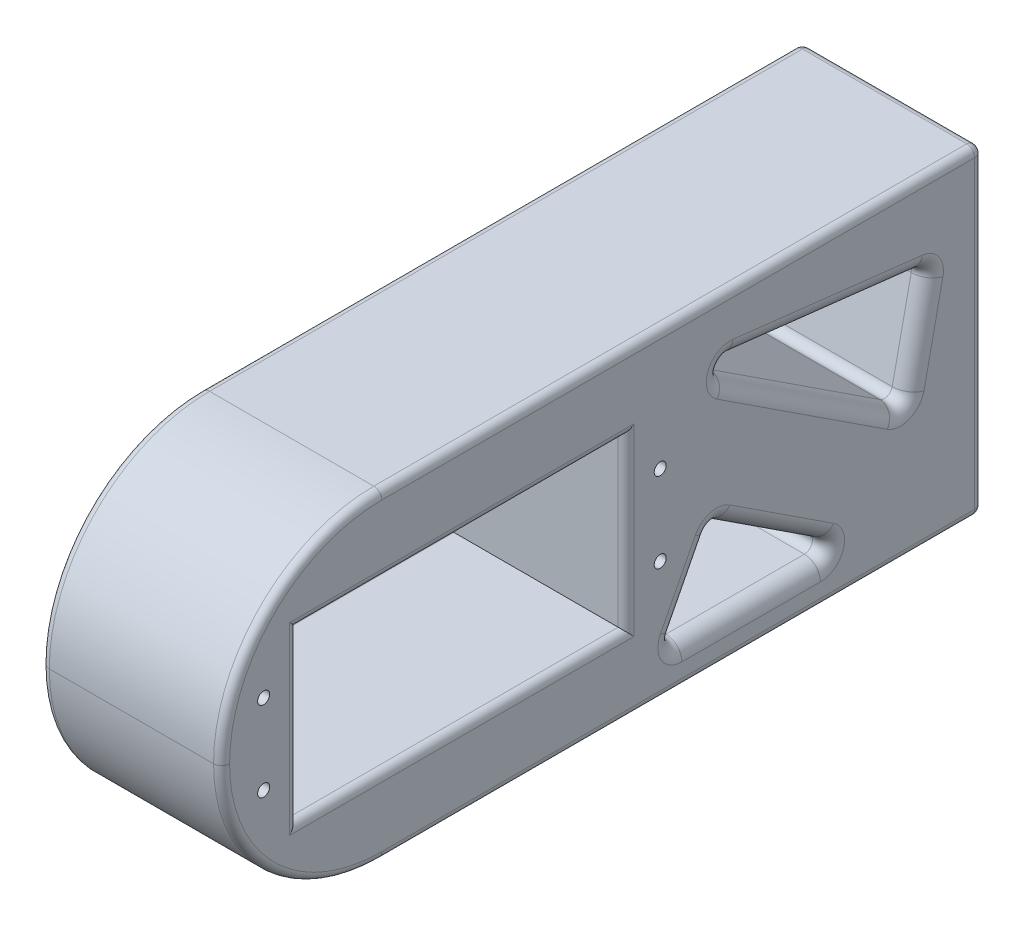
from build123d import *

# Parameters (mm, degrees)
MBODY_DEPTH        = 40
SKETCH5_R          = 0.75
FRONTSCREWS_DEPTH  = 3
SKETCH7_R          = 2.75
GUIDKNOB_DEPTH     = 4
SERVOCUT_DEPTH     = 40.5
ROUNDEND_R         = 20
SKETCH15_R         = 0.75
SERVOSCREWS_DEPTH  = 3
EDGES1MM_R         = 1
CUT_EXTRUDE2_DEPTH = 25
FILLET5_R          = 2


with BuildPart() as part:
    # Sketch4 → MBODY (new body)
    with BuildSketch(Plane(origin=(0, 0, 0), x_dir=(1, 0, 0), z_dir=(0, 1, 0))):
        Polygon((-5, 20), (-16.25, 20), (-16.25, -75), (-5, -75), (6.25, -75), (6.25, 20), align=None)
    extrude(amount=MBODY_DEPTH)

    # Sketch5 → FrontScrews (cut)
    with BuildSketch(Plane(origin=(0, 0, -20), x_dir=(-1, 0, 0), z_dir=(0, 0, -1))):
        with Locations((0, 5)):
            Circle(SKETCH5_R)
        with Locations((10, 5)):
            Circle(SKETCH5_R)
        with Locations((10, 15)):
            Circle(SKETCH5_R)
        with Locations((0, 15)):
            Circle(SKETCH5_R)
        with Locations((0, 25)):
            Circle(SKETCH5_R)
        with Locations((10, 25)):
            Circle(SKETCH5_R)
        with Locations((10, 35)):
            Circle(SKETCH5_R)
        with Locations((0, 35)):
            Circle(SKETCH5_R)
    extrude(amount=-FRONTSCREWS_DEPTH, mode=Mode.SUBTRACT)

    # Sketch7 → GUIDKNOB (add)
    with BuildSketch(Plane(origin=(0, 0, -20), x_dir=(-1, 0, 0), z_dir=(0, 0, -1))):
        with Locations((5, 20)):
            Circle(SKETCH7_R)
    extrude(amount=GUIDKNOB_DEPTH)

    # Sketch10 → ServoCut (cut)
    with BuildSketch(Plane(origin=(6.25, 0, 0), x_dir=(0, 0, -1), z_dir=(1, 0, 0))):
        Polygon((-65.5, 20), (-65.5, 30.5), (-24.5, 30.5), (-24.5, 9.5), (-65.5, 9.5), align=None)
    extrude(amount=-SERVOCUT_DEPTH, mode=Mode.SUBTRACT)

    # RoundEnd
    roundend_edges = [part.edges().sort_by_distance(p)[0] for p in [
        (-5, 0, 75),
        (-5, 40, 75),
    ]]
    fillet(roundend_edges, radius=ROUNDEND_R - 0.0001)  # a hair under: the kernel refuses the full size

    # Sketch15 → ServoScrews (cut)
    with BuildSketch(Plane(origin=(6.25, 33.75, 0), x_dir=(0, 1, 0), z_dir=(-1, 0, 0))):
        with Locations(Location((-18.75, -69.75, 0), (0, 0, 270))):
            Circle(SKETCH15_R)
        with Locations(Location((-8.75, -69.75, 0), (0, 0, 270))):
            Circle(SKETCH15_R)
        with Locations(Location((-8.75, -20.25, 0), (0, 0, 270))):
            Circle(SKETCH15_R)
        with Locations(Location((-18.75, -20.25, 0), (0, 0, 270))):
            Circle(SKETCH15_R)
    extrude(amount=SERVOSCREWS_DEPTH, mode=Mode.SUBTRACT)

    # EDGES1MM
    edges1mm_edges = [part.edges().sort_by_distance(p)[0] for p in [
        (-16.25, 20, -20),
        (6.25, 20, -20),
        (6.25, 40, 17.50005),
        (-5, 40, -20),
        (-16.25, 40, 17.50005),
        (6.25, 20, 65.5),
        (6.25, 30.5, 45),
        (-16.25, 20, 24.5),
        (-16.25, 9.5, 45),
        (-16.25, 20, 65.5),
        (-16.25, 30.5, 45),
        (-5, 0, -20),
        (6.25, 9.5, 45),
        (6.25, 20, 24.5),
        (6.25, 0, 17.50005),
        (6.25, 34.142164913, 69.142164913),
        (6.25, 5.857835087, 69.142164913),
        (-16.25, 34.142164913, 69.142164913),
        (-16.25, 5.857835087, 69.142164913),
        (-16.25, 0, 17.50005),
    ]]
    fillet(edges1mm_edges, radius=EDGES1MM_R)

    # Sketch20 → Cut-Extrude2 (cut)
    with BuildSketch(Plane.ZY.offset(16.25)):
        with BuildLine():
            Line((-12.215168046, 29.74634987), (11.383359391, 32.473817865))
            ThreePointArc((11.383359391, 32.473817865), (12.438571666, 31.820504762), (12.045296334, 30.643378825))
            Line((12.045296334, 30.643378825), (-9.181519802, 16.768867719))
            ThreePointArc((-9.181519802, 16.768867719), (-10.109863888, 16.681435652), (-10.706749095, 17.397812059))
            Line((-10.706749095, 17.397812059), (-13.078460395, 28.54485517))
            ThreePointArc((-13.078460395, 28.54485517), (-12.91246015, 29.33647319), (-12.215168046, 29.74634987))
        make_face()
        with BuildLine():
            Line((12.659206955, 15.077659132), (-0.290565805, 6.613282524))
            ThreePointArc((-0.290565805, 6.613282524), (-0.701840058, 5.490794018), (0.256557559, 4.776230539))
            Line((0.256557559, 4.776230539), (17.543908561, 4.776230539))
            ThreePointArc((17.543908561, 4.776230539), (18.397154203, 5.254721313), (18.433859511, 6.232286792))
            Line((18.433859511, 6.232286792), (14.09628127, 14.696663401))
            ThreePointArc((14.09628127, 14.696663401), (13.462596051, 15.207213518), (12.659206955, 15.077659132))
        make_face()
    extrude(amount=-CUT_EXTRUDE2_DEPTH, mode=Mode.SUBTRACT)

    # Fillet5
    fillet5_edges = [part.edges().sort_by_distance(p)[0] for p in [
        (6.25, 31.110083867, -0.415904328),
        (6.25, 29.33647319, -12.91246015),
        (6.25, 22.971333615, -11.892604745),
        (6.25, 16.681435652, -10.109863888),
        (6.25, 23.706123272, 1.431888266),
        (6.25, 31.820504762, 12.438571666),
        (6.25, 10.845470828, 6.184320575),
        (6.25, 5.490794018, -0.701840058),
        (6.25, 4.776230539, 8.90023306),
        (6.25, 5.254721313, 18.397154203),
        (6.25, 10.464475096, 16.26507039),
        (6.25, 15.207213518, 13.462596051),
        (-16.25, 15.207213518, 13.462596051),
        (-16.25, 10.845470828, 6.184320575),
        (-16.25, 5.490794018, -0.701840058),
        (-16.25, 4.776230539, 8.90023306),
        (-16.25, 5.254721313, 18.397154203),
        (-16.25, 10.464475096, 16.26507039),
        (-16.25, 31.820504762, 12.438571666),
        (-16.25, 31.110083867, -0.415904328),
        (-16.25, 29.33647319, -12.91246015),
        (-16.25, 22.971333615, -11.892604745),
        (-16.25, 16.681435652, -10.109863888),
        (-16.25, 23.706123272, 1.431888266),
    ]]
    fillet(fillet5_edges, radius=FILLET5_R)


solid = part.part
